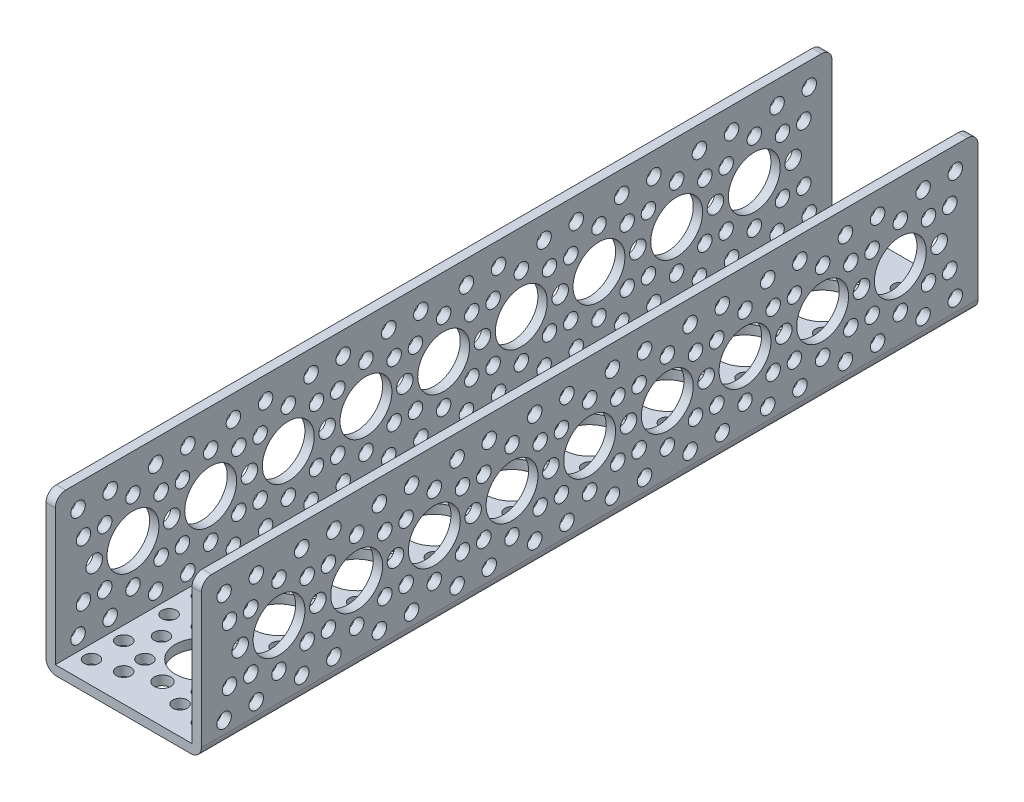
from build123d import *

# Parameters (mm, degrees)
SKETCH1_W                  = 38.1
SKETCH1_H                  = 190.5
BOSS_EXTRUDE1_DEPTH        = 38.1
SKETCH2_W                  = 33.528
SKETCH2_H                  = 35.814
CUT_EXTRUDE1_DEPTH         = 198.973407305
HOLE1_D                    = 12.7254
HOLE1_DEPTH                = 2.286
M3_CLEARANCE_HOLE1_D       = 3.556
M3_CLEARANCE_HOLE1_DEPTH   = 2.286
M3_5_CLEARANCE_HOLE1_D     = 4.064
M3_5_CLEARANCE_HOLE1_DEPTH = 2.286
HOLE2_D                    = 12.7254
HOLE2_DEPTH                = 38.1
M3_5_CLEARANCE_HOLE2_D     = 4.064
M3_5_CLEARANCE_HOLE2_DEPTH = 38.1
M3_CLEARANCE_HOLE2_D       = 3.556
M3_CLEARANCE_HOLE2_DEPTH   = 38.1
HOLE3_D                    = 12.7254
HOLE3_DEPTH                = 38.1
M3_CLEARANCE_HOLE3_D       = 3.556
M3_CLEARANCE_HOLE3_DEPTH   = 38.1
M3_5_CLEARANCE_HOLE3_D     = 4.064
M3_5_CLEARANCE_HOLE3_DEPTH = 38.1
FILLET1_R                  = 2.54


with BuildPart() as part:
    # Sketch1 → Boss-Extrude1 (new body)
    with BuildSketch(Plane.XZ):
        with Locations((19.05, 95.25)):
            Rectangle(SKETCH1_W, SKETCH1_H)
    extrude(amount=-BOSS_EXTRUDE1_DEPTH)

    # Sketch2 → Cut-Extrude1 (cut, through all)
    with BuildSketch(Plane.XY.offset(190.5)):
        with Locations((19.05, 20.193)):
            Rectangle(SKETCH2_W, SKETCH2_H)
    extrude(amount=-CUT_EXTRUDE1_DEPTH, mode=Mode.SUBTRACT)

    # Hole1
    with Locations(Plane(origin=(38.1, 0, 0), x_dir=(0, 0, -1), z_dir=(1, 0, 0))):
        with Locations((-38.1, 19.05), (-19.05, 19.05), (-57.15, 19.05), (-76.2, 19.05), (-95.25, 19.05), (-114.3, 19.05), (-133.35, 19.05), (-152.4, 19.05), (-171.45, 19.05)):
            Hole(HOLE1_D / 2, depth=HOLE1_DEPTH)

    # M3 Clearance Hole1
    with Locations(Plane(origin=(38.1, 0, 0), x_dir=(0, 0, -1), z_dir=(1, 0, 0))):
        with Locations((-177.029615818, 5.579615818), (-183.585202787, 12.135202787), (-177.029615818, 32.520384182), (-183.585202787, 25.964797213), (-13.470384182, 5.579615818), (-6.914797213, 12.135202787), (-13.470384182, 32.520384182), (-6.914797213, 25.964797213), (-157.979615818, 5.579615818), (-138.929615818, 5.579615818), (-119.879615818, 5.579615818), (-100.829615818, 5.579615818), (-81.779615818, 5.579615818), (-62.729615818, 5.579615818), (-43.679615818, 5.579615818), (-24.629615818, 5.579615818), (-157.979615818, 32.520384182), (-138.929615818, 32.520384182), (-119.879615818, 32.520384182), (-100.829615818, 32.520384182), (-81.779615818, 32.520384182), (-62.729615818, 32.520384182), (-43.679615818, 32.520384182), (-24.629615818, 32.520384182), (-184.920384182, 5.579615818), (-184.920384182, 32.520384182), (-165.870384182, 5.579615818), (-165.870384182, 32.520384182), (-146.820384182, 5.579615818), (-146.820384182, 32.520384182), (-127.770384182, 5.579615818), (-127.770384182, 32.520384182), (-108.720384182, 5.579615818), (-108.720384182, 32.520384182), (-89.670384182, 5.579615818), (-89.670384182, 32.520384182), (-70.620384182, 5.579615818), (-70.620384182, 32.520384182), (-51.570384182, 5.579615818), (-51.570384182, 32.520384182), (-38.1, 9.271), (-45.014797213, 12.135202787), (-45.014797213, 25.964797213), (-38.1, 28.829), (-31.185202787, 25.964797213), (-31.185202787, 12.135202787), (-32.520384182, 5.579615818), (-32.520384182, 32.520384182), (-5.579615818, 5.579615818), (-5.579615818, 32.520384182), (-12.135202787, 12.135202787), (-19.05, 9.271), (-25.964797213, 12.135202787), (-25.964797213, 25.964797213), (-19.05, 28.829), (-12.135202787, 25.964797213), (-50.235202787, 12.135202787), (-69.285202787, 12.135202787), (-88.335202787, 12.135202787), (-107.385202787, 12.135202787), (-126.435202787, 12.135202787), (-145.485202787, 12.135202787), (-164.535202787, 12.135202787), (-50.235202787, 25.964797213), (-69.285202787, 25.964797213), (-88.335202787, 25.964797213), (-107.385202787, 25.964797213), (-126.435202787, 25.964797213), (-145.485202787, 25.964797213), (-164.535202787, 25.964797213), (-57.15, 28.829), (-76.2, 28.829), (-95.25, 28.829), (-114.3, 28.829), (-133.35, 28.829), (-152.4, 28.829), (-171.45, 28.829), (-64.064797213, 25.964797213), (-83.114797213, 25.964797213), (-102.164797213, 25.964797213), (-121.214797213, 25.964797213), (-140.264797213, 25.964797213), (-159.314797213, 25.964797213), (-178.364797213, 25.964797213), (-64.064797213, 12.135202787), (-83.114797213, 12.135202787), (-102.164797213, 12.135202787), (-121.214797213, 12.135202787), (-140.264797213, 12.135202787), (-159.314797213, 12.135202787), (-178.364797213, 12.135202787), (-57.15, 9.271), (-76.2, 9.271), (-95.25, 9.271), (-114.3, 9.271), (-133.35, 9.271), (-152.4, 9.271), (-171.45, 9.271)):
            Hole(M3_CLEARANCE_HOLE1_D / 2, depth=M3_CLEARANCE_HOLE1_DEPTH)

    # M3.5 Clearance Hole1
    with Locations(Plane(origin=(38.1, 0, 0), x_dir=(0, 0, -1), z_dir=(1, 0, 0))):
        with Locations((-180.975, 19.05), (-161.925, 19.05), (-142.875, 19.05), (-123.825, 19.05), (-104.775, 19.05), (-85.725, 19.05), (-66.675, 19.05), (-47.625, 19.05), (-28.575, 19.05), (-9.525, 19.05)):
            Hole(M3_5_CLEARANCE_HOLE1_D / 2, depth=M3_5_CLEARANCE_HOLE1_DEPTH)

    # Hole2
    with Locations(Plane(origin=(0, 0, 0), x_dir=(-1, 0, 0), z_dir=(0, -1, 0))):
        with Locations((-19.05, -171.45), (-19.05, -152.4), (-19.05, -133.35), (-19.05, -114.3), (-19.05, -95.25), (-19.05, -76.2), (-19.05, -57.15), (-19.05, -38.1), (-19.05, -19.05)):
            Hole(HOLE2_D / 2, depth=HOLE2_DEPTH)

    # M3.5 Clearance Hole2
    with Locations(Plane(origin=(0, 0, 0), x_dir=(-1, 0, 0), z_dir=(0, -1, 0))):
        with Locations((-19.05, -180.975), (-19.05, -161.925), (-19.05, -142.875), (-19.05, -123.825), (-19.05, -104.775), (-19.05, -85.725), (-19.05, -66.675), (-19.05, -47.625), (-19.05, -28.575), (-19.05, -9.525)):
            Hole(M3_5_CLEARANCE_HOLE2_D / 2, depth=M3_5_CLEARANCE_HOLE2_DEPTH)

    # M3 Clearance Hole2
    with Locations(Plane(origin=(0, 0, 0), x_dir=(-1, 0, 0), z_dir=(0, -1, 0))):
        with Locations((-5.579615818, -184.920384182), (-5.579615818, -177.029615818), (-12.135202787, -183.585202787), (-32.520384182, -184.920384182), (-32.520384182, -177.029615818), (-25.964797213, -183.585202787), (-5.579615818, -165.870384182), (-5.579615818, -157.979615818), (-32.520384182, -165.870384182), (-32.520384182, -157.979615818), (-5.579615818, -146.820384182), (-5.579615818, -138.929615818), (-32.520384182, -146.820384182), (-32.520384182, -138.929615818), (-5.579615818, -127.770384182), (-5.579615818, -119.879615818), (-32.520384182, -127.770384182), (-32.520384182, -119.879615818), (-5.579615818, -108.720384182), (-5.579615818, -100.829615818), (-32.520384182, -108.720384182), (-32.520384182, -100.829615818), (-5.579615818, -89.670384182), (-5.579615818, -81.779615818), (-32.520384182, -89.670384182), (-32.520384182, -81.779615818), (-5.579615818, -70.620384182), (-5.579615818, -62.729615818), (-32.520384182, -70.620384182), (-32.520384182, -62.729615818), (-5.579615818, -51.570384182), (-5.579615818, -43.679615818), (-32.520384182, -51.570384182), (-32.520384182, -43.679615818), (-12.135202787, -164.535202787), (-9.271, -171.45), (-12.135202787, -178.364797213), (-25.964797213, -178.364797213), (-28.829, -171.45), (-25.964797213, -164.535202787), (-12.135202787, -145.485202787), (-9.271, -152.4), (-12.135202787, -159.314797213), (-25.964797213, -159.314797213), (-28.829, -152.4), (-25.964797213, -145.485202787), (-12.135202787, -126.435202787), (-9.271, -133.35), (-12.135202787, -140.264797213), (-25.964797213, -140.264797213), (-28.829, -133.35), (-25.964797213, -126.435202787), (-12.135202787, -107.385202787), (-9.271, -114.3), (-12.135202787, -121.214797213), (-25.964797213, -121.214797213), (-28.829, -114.3), (-25.964797213, -107.385202787), (-12.135202787, -88.335202787), (-9.271, -95.25), (-12.135202787, -102.164797213), (-25.964797213, -102.164797213), (-28.829, -95.25), (-25.964797213, -88.335202787), (-12.135202787, -69.285202787), (-9.271, -76.2), (-12.135202787, -83.114797213), (-25.964797213, -83.114797213), (-28.829, -76.2), (-25.964797213, -69.285202787), (-12.135202787, -50.235202787), (-9.271, -57.15), (-12.135202787, -64.064797213), (-25.964797213, -64.064797213), (-28.829, -57.15), (-25.964797213, -50.235202787), (-9.271, -38.1), (-12.135202787, -45.014797213), (-25.964797213, -45.014797213), (-28.829, -38.1), (-5.579615818, -32.520384182), (-5.579615818, -24.629615818), (-12.135202787, -31.185202787), (-32.520384182, -32.520384182), (-32.520384182, -24.629615818), (-25.964797213, -31.185202787), (-5.579615818, -5.579615818), (-5.579615818, -13.470384182), (-12.135202787, -6.914797213), (-32.520384182, -5.579615818), (-32.520384182, -13.470384182), (-25.964797213, -6.914797213), (-12.135202787, -12.135202787), (-9.271, -19.05), (-12.135202787, -25.964797213), (-25.964797213, -25.964797213), (-28.829, -19.05), (-25.964797213, -12.135202787)):
            Hole(M3_CLEARANCE_HOLE2_D / 2, depth=M3_CLEARANCE_HOLE2_DEPTH)

    # Hole3
    with Locations(Plane.ZY):
        with Locations((38.1, 19.05), (19.05, 19.05), (57.15, 19.05), (76.2, 19.05), (95.25, 19.05), (114.3, 19.05), (133.35, 19.05), (152.4, 19.05), (171.45, 19.05)):
            Hole(HOLE3_D / 2, depth=HOLE3_DEPTH)

    # M3 Clearance Hole3
    with Locations(Plane.ZY):
        with Locations((177.029615818, 5.579615818), (183.585202787, 12.135202787), (177.029615818, 32.520384182), (183.585202787, 25.964797213), (13.470384182, 5.579615818), (6.914797213, 12.135202787), (13.470384182, 32.520384182), (6.914797213, 25.964797213), (157.979615818, 5.579615818), (138.929615818, 5.579615818), (119.879615818, 5.579615818), (100.829615818, 5.579615818), (81.779615818, 5.579615818), (62.729615818, 5.579615818), (43.679615818, 5.579615818), (24.629615818, 5.579615818), (157.979615818, 32.520384182), (138.929615818, 32.520384182), (119.879615818, 32.520384182), (100.829615818, 32.520384182), (81.779615818, 32.520384182), (62.729615818, 32.520384182), (43.679615818, 32.520384182), (24.629615818, 32.520384182), (184.920384182, 5.579615818), (184.920384182, 32.520384182), (165.870384182, 5.579615818), (165.870384182, 32.520384182), (146.820384182, 5.579615818), (146.820384182, 32.520384182), (127.770384182, 5.579615818), (127.770384182, 32.520384182), (108.720384182, 5.579615818), (108.720384182, 32.520384182), (89.670384182, 5.579615818), (89.670384182, 32.520384182), (70.620384182, 5.579615818), (70.620384182, 32.520384182), (51.570384182, 5.579615818), (51.570384182, 32.520384182), (31.185202787, 12.135202787), (38.1, 9.271), (45.014797213, 12.135202787), (45.014797213, 25.964797213), (38.1, 28.829), (31.185202787, 25.964797213), (32.520384182, 5.579615818), (32.520384182, 32.520384182), (5.579615818, 5.579615818), (5.579615818, 32.520384182), (12.135202787, 12.135202787), (19.05, 9.271), (25.964797213, 12.135202787), (25.964797213, 25.964797213), (19.05, 28.829), (12.135202787, 25.964797213), (50.235202787, 25.964797213), (69.285202787, 25.964797213), (88.335202787, 25.964797213), (107.385202787, 25.964797213), (126.435202787, 25.964797213), (145.485202787, 25.964797213), (164.535202787, 25.964797213), (57.15, 28.829), (76.2, 28.829), (95.25, 28.829), (114.3, 28.829), (133.35, 28.829), (152.4, 28.829), (171.45, 28.829), (64.064797213, 25.964797213), (83.114797213, 25.964797213), (102.164797213, 25.964797213), (121.214797213, 25.964797213), (140.264797213, 25.964797213), (159.314797213, 25.964797213), (178.364797213, 25.964797213), (64.064797213, 12.135202787), (83.114797213, 12.135202787), (102.164797213, 12.135202787), (121.214797213, 12.135202787), (140.264797213, 12.135202787), (159.314797213, 12.135202787), (178.364797213, 12.135202787), (57.15, 9.271), (76.2, 9.271), (95.25, 9.271), (114.3, 9.271), (133.35, 9.271), (152.4, 9.271), (171.45, 9.271), (50.235202787, 12.135202787), (69.285202787, 12.135202787), (88.335202787, 12.135202787), (107.385202787, 12.135202787), (126.435202787, 12.135202787), (145.485202787, 12.135202787), (164.535202787, 12.135202787)):
            Hole(M3_CLEARANCE_HOLE3_D / 2, depth=M3_CLEARANCE_HOLE3_DEPTH)

    # M3.5 Clearance Hole3
    with Locations(Plane.ZY):
        with Locations((180.975, 19.05), (161.925, 19.05), (142.875, 19.05), (123.825, 19.05), (104.775, 19.05), (85.725, 19.05), (66.675, 19.05), (47.625, 19.05), (28.575, 19.05), (9.525, 19.05)):
            Hole(M3_5_CLEARANCE_HOLE3_D / 2, depth=M3_5_CLEARANCE_HOLE3_DEPTH)

    # Fillet1
    fillet1_edges = [part.edges().sort_by_distance(p)[0] for p in [
        (1.143, 38.1, 190.5),
        (36.957, 38.1, 190.5),
        (36.957, 38.1, 0),
        (38.1, 0, 95.25),
        (1.143, 38.1, 0),
        (0, 0, 95.25),
    ]]
    fillet(fillet1_edges, radius=FILLET1_R)


solid = part.part
